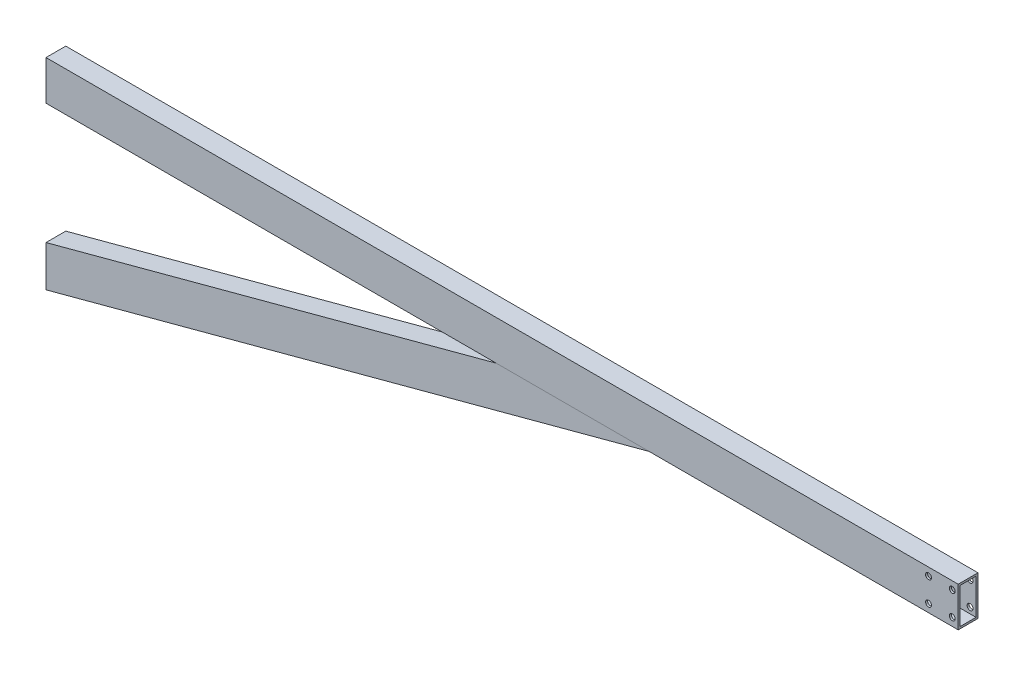
from build123d import *

# Parameters (mm, degrees)
HS_START                 = -5
HS_10X20X1_1_DEPTH       = 1
HS_START_2               = 4
HS_10X20X1_1_2_DEPTH     = 1
HS_START_3               = -4
HS_10X20X1_1_3_DEPTH     = 8
HS_START_4               = 93
HS_10X20X1_1_4_OUTLINE_W = 461
HS_10X20X1_1_4_OUTLINE_H = 1
HS_10X20X1_1_4_DEPTH     = 20
HS_10X20X1_1_5_OUTLINE_W = 461
HS_10X20X1_1_5_OUTLINE_H = 8
HS_10X20X1_1_5_DEPTH     = 1
HS_START_5               = 112
HS_10X20X1_1_6_OUTLINE_W = 461
HS_10X20X1_1_6_OUTLINE_H = 8
HS_10X20X1_1_6_DEPTH     = 1
HS_START_6               = -10
HS_10X20X1_1_7_OUTLINE_W = 116
HS_10X20X1_1_7_OUTLINE_H = 1
HS_10X20X1_1_7_DEPTH     = 20
HS_10X20X1_1_8_OUTLINE_W = 116
HS_10X20X1_1_8_OUTLINE_H = 8
HS_10X20X1_1_8_DEPTH     = 1
HS_START_7               = 9
HS_10X20X1_1_9_OUTLINE_W = 116
HS_10X20X1_1_9_OUTLINE_H = 8
HS_10X20X1_1_9_DEPTH     = 1
SKETCH_2_W               = 20
SKETCH_2_H               = 116
CUT_EXTRUDE_1_DEPTH      = 10
SKETCH_4_R               = 1.5
CUT_EXTRUDE_3_DEPTH      = 41


# Read off the part's stored shape, not the designer's step: Hs 10X20X1(1)
with BuildPart() as part:
    # Hs 10X20X1(1) outline → Hs 10X20X1(1) (new body)
    with BuildSketch(Plane.XY.offset(HS_START)):
        Polygon((10, 32.032253728), (10, 11.32673012), (314.808792812, 93), (237.534726709, 93), align=None)
    extrude(amount=HS_10X20X1_1_DEPTH)

    # Hs 10X20X1_1 2 outline → Hs 10X20X1_1 2 (add)
    with BuildSketch(Plane.XY.offset(HS_START_2)):
        Polygon((10, 32.032253728), (10, 11.32673012), (314.808792812, 93), (237.534726709, 93), align=None)
    extrude(amount=HS_10X20X1_1_2_DEPTH)

    # Hs 10X20X1_1 3 outline → Hs 10X20X1_1 3 (add)
    with BuildSketch(Plane.XY.offset(HS_START_3)):
        Polygon((10, 32.032253728), (10, 30.996977548), (241.398430014, 93), (237.534726709, 93), align=None)
        Polygon((310.945089507, 93), (10, 12.362006301), (10, 11.32673012), (314.808792812, 93), align=None)
    extrude(amount=HS_10X20X1_1_3_DEPTH)


with BuildPart() as body_2:
    # Hs 10X20X1_1 4 outline → Hs 10X20X1_1 4 (new body)
    with BuildSketch(Plane(origin=(0, 0, 0), x_dir=(1, 0, 0), z_dir=(0, 1, 0)).offset(HS_START_4)):
        with Locations((240.5, -4.5)):
            Rectangle(HS_10X20X1_1_4_OUTLINE_W, HS_10X20X1_1_4_OUTLINE_H)
        with Locations((240.5, 4.5)):
            Rectangle(HS_10X20X1_1_4_OUTLINE_W, HS_10X20X1_1_4_OUTLINE_H)
    extrude(amount=HS_10X20X1_1_4_DEPTH)

    # Hs 10X20X1_1 5 outline → Hs 10X20X1_1 5 (add)
    with BuildSketch(Plane(origin=(0, 0, 0), x_dir=(1, 0, 0), z_dir=(0, 1, 0)).offset(HS_START_4)):
        with Locations((240.5, 0)):
            Rectangle(HS_10X20X1_1_5_OUTLINE_W, HS_10X20X1_1_5_OUTLINE_H)
    extrude(amount=HS_10X20X1_1_5_DEPTH)

    # Hs 10X20X1_1 6 outline → Hs 10X20X1_1 6 (add)
    with BuildSketch(Plane(origin=(0, 0, 0), x_dir=(1, 0, 0), z_dir=(0, 1, 0)).offset(HS_START_5)):
        with Locations((240.5, 0)):
            Rectangle(HS_10X20X1_1_6_OUTLINE_W, HS_10X20X1_1_6_OUTLINE_H)
    extrude(amount=HS_10X20X1_1_6_DEPTH)

    # 草图4 → 切除-拉伸3 (cut)
    with BuildSketch(Plane.XY.offset(5)):
        with Locations((456, 109)):
            Circle(SKETCH_4_R)
        with Locations((456, 97)):
            Circle(SKETCH_4_R)
        with Locations((468, 97)):
            Circle(SKETCH_4_R)
        with Locations((468, 109)):
            Circle(SKETCH_4_R)
    extrude(amount=-CUT_EXTRUDE_3_DEPTH, mode=Mode.SUBTRACT)


with BuildPart() as body_3:
    # Hs 10X20X1_1 7 outline → Hs 10X20X1_1 7 (new body)
    with BuildSketch(Plane.YZ.offset(HS_START_6)):
        with Locations((58, -4.5)):
            Rectangle(HS_10X20X1_1_7_OUTLINE_W, HS_10X20X1_1_7_OUTLINE_H)
        with Locations((58, 4.5)):
            Rectangle(HS_10X20X1_1_7_OUTLINE_W, HS_10X20X1_1_7_OUTLINE_H)
    extrude(amount=HS_10X20X1_1_7_DEPTH)

    # Hs 10X20X1_1 8 outline → Hs 10X20X1_1 8 (add)
    with BuildSketch(Plane.YZ.offset(HS_START_6)):
        with Locations((58, 0)):
            Rectangle(HS_10X20X1_1_8_OUTLINE_W, HS_10X20X1_1_8_OUTLINE_H)
    extrude(amount=HS_10X20X1_1_8_DEPTH)

    # Hs 10X20X1_1 9 outline → Hs 10X20X1_1 9 (add)
    with BuildSketch(Plane.YZ.offset(HS_START_7)):
        with Locations((58, 0)):
            Rectangle(HS_10X20X1_1_9_OUTLINE_W, HS_10X20X1_1_9_OUTLINE_H)
    extrude(amount=HS_10X20X1_1_9_DEPTH)

    # 草图2 → 切除-拉伸1 (cut)
    with BuildSketch(Plane.XY.offset(5)):
        with Locations((0, 58)):
            Rectangle(SKETCH_2_W, SKETCH_2_H)
    extrude(amount=-CUT_EXTRUDE_1_DEPTH, mode=Mode.SUBTRACT)


solid = Compound([part.part, body_2.part])
